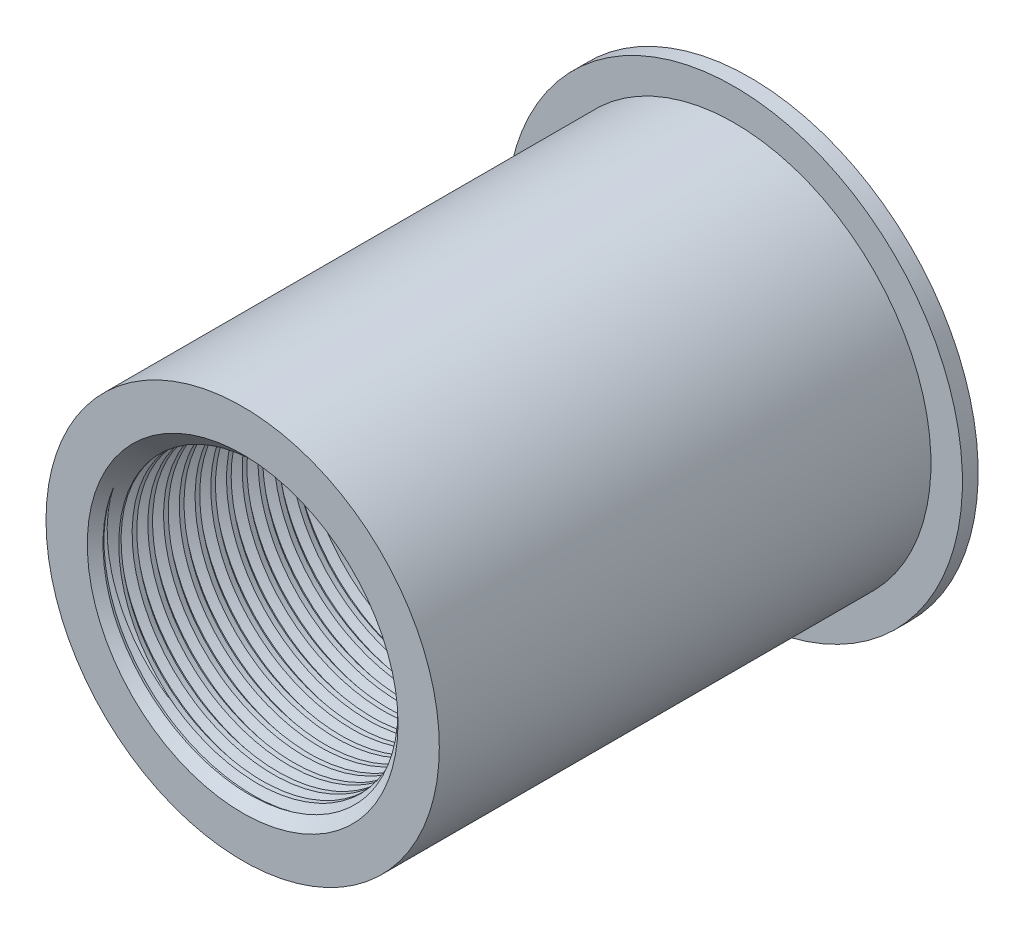
from build123d import *

# Parameters (mm, degrees)
SKETCH1_R          = 3.175
EXTRUDE1_DEPTH     = 8.1915
SKETCH6_R          = 3.683
SKETCH6_R_2        = 3.175
EXTRUDE2_DEPTH     = 0.254
SKETCH4_R          = 2.25425
CUT_EXTRUDE1_DEPTH = 10.707195797
CUT_SWEEP1_PITCH   = 0.254


with BuildPart() as part:
    # Sketch1 → Extrude1 (new body)
    with BuildSketch(Plane.XY):
        Circle(SKETCH1_R)
    extrude(amount=EXTRUDE1_DEPTH)

    # Sketch6 → Extrude2 (add)
    with BuildSketch(Plane(origin=(0, 0, 0), x_dir=(-1, 0, 0), z_dir=(0, 0, -1))):
        Circle(SKETCH6_R)
        Circle(SKETCH6_R_2, mode=Mode.SUBTRACT)
    extrude(amount=-EXTRUDE2_DEPTH)

    # Sketch4 → Cut-Extrude1 (cut, through all)
    with BuildSketch(Plane(origin=(0, 0, 0), x_dir=(-1, 0, 0), z_dir=(0, 0, -1))):
        Circle(SKETCH4_R)
    extrude(amount=-CUT_EXTRUDE1_DEPTH, mode=Mode.SUBTRACT)

    # Cut-Extrude2 cone 1 section (through the dimple's axis) → Cut-Extrude2 (revolve, cut)
    with BuildSketch(Plane.YZ):
        Polygon((0, 0), (2.50825, 0), (0, 2.50825), align=None)
    revolve(axis=Axis((0, 0, 0), (0, 0, 1)), mode=Mode.SUBTRACT)

    # Cut-Extrude3 cone 1 section (through the dimple's axis) → Cut-Extrude3 (revolve, cut)
    with BuildSketch(Plane(origin=(0, 0, 8.1915), x_dir=(0, -1, 0), z_dir=(1, 0, 0))):
        Polygon((0, 0), (2.50825, 0), (0, 2.50825), align=None)
    revolve(axis=Axis((0, 0, 8.1915), (0, 0, -1)), mode=Mode.SUBTRACT)

    # Cut-Sweep1: the profile of Sketch3 screwed along a left-hand helix of 32.25 turns, 6 arcs to a turn; built about Z, then put on its axis
    cut_sweep1_z = Axis((0, 0, 0), (0, 0, 1))
    cut_sweep1_corners = [(2.38125, 0, 0.015875), (2.38125, 0, -0.015875), (2.216272161, 0, -0.111125), (2.216272161, 0, 0.111125)]
    with BuildLine(mode=Mode.PRIVATE) as cut_sweep1_profile:
        Line(cut_sweep1_corners[0], cut_sweep1_corners[1])
        Line(cut_sweep1_corners[1], cut_sweep1_corners[2])
        Line(cut_sweep1_corners[2], cut_sweep1_corners[3])
        Line(cut_sweep1_corners[3], cut_sweep1_corners[0])
    cut_sweep1_cap = Face(cut_sweep1_profile.wire())
    cut_sweep1_turn_angles = [0, -30, -60, -90, -120, -150, -180, -210, -240, -270, -300, -330, -360]
    cut_sweep1_turn_weights = [1, 0.8660254037844387, 1, 0.8660254037844387, 1, 0.8660254037844387, 1, 0.8660254037844387, 1, 0.8660254037844387, 1, 0.8660254037844387, 1]
    cut_sweep1_turn_rails = [Edge.make_bspline([Vector(p[0], p[1], 0).rotate(cut_sweep1_z, cut_sweep1_turn_angles[k]) / cut_sweep1_turn_weights[k] + Vector(0, 0, p[2] + -CUT_SWEEP1_PITCH * cut_sweep1_turn_angles[k] / 360) for k in range(13)], [0, 0, 0, 1, 1, 2, 2, 3, 3, 4, 4, 5, 5, 6, 6, 6], 2, cut_sweep1_turn_weights) for p in cut_sweep1_corners]
    cut_sweep1_turn_sides = [Face.make_surface_from_curves(cut_sweep1_turn_rails[p[0]], cut_sweep1_turn_rails[p[1]]) for p in [(0, 1), (1, 2), (2, 3), (3, 0)]]
    cut_sweep1_last_angles = [-11520, -11550, -11580, -11595, -11610]
    cut_sweep1_last_weights = [1, 0.8660254037844387, 1, 0.9659258262894544, 1]
    cut_sweep1_last_rails = [Edge.make_bspline([Vector(p[0], p[1], 0).rotate(cut_sweep1_z, cut_sweep1_last_angles[k]) / cut_sweep1_last_weights[k] + Vector(0, 0, p[2] + -CUT_SWEEP1_PITCH * cut_sweep1_last_angles[k] / 360) for k in range(5)], [0, 0, 0, 1, 1, 2, 2, 2], 2, cut_sweep1_last_weights) for p in cut_sweep1_corners]
    cut_sweep1_last_sides = [Face.make_surface_from_curves(cut_sweep1_last_rails[p[0]], cut_sweep1_last_rails[p[1]]) for p in [(0, 1), (1, 2), (2, 3), (3, 0)]]
    cut_sweep1 = Plane(origin=(0, 0, 0), x_dir=(0, 1, 0), z_dir=(0, 0, 1)) * Solid(Shell([*[p.moved(Location((0, 0, CUT_SWEEP1_PITCH * i))) for i in range(32) for p in cut_sweep1_turn_sides], *cut_sweep1_last_sides, cut_sweep1_cap, cut_sweep1_cap.rotate(cut_sweep1_z, -11610).moved(Location((0, 0, -CUT_SWEEP1_PITCH * -11610 / 360)))]))
    add(cut_sweep1, mode=Mode.SUBTRACT)


solid = part.part
